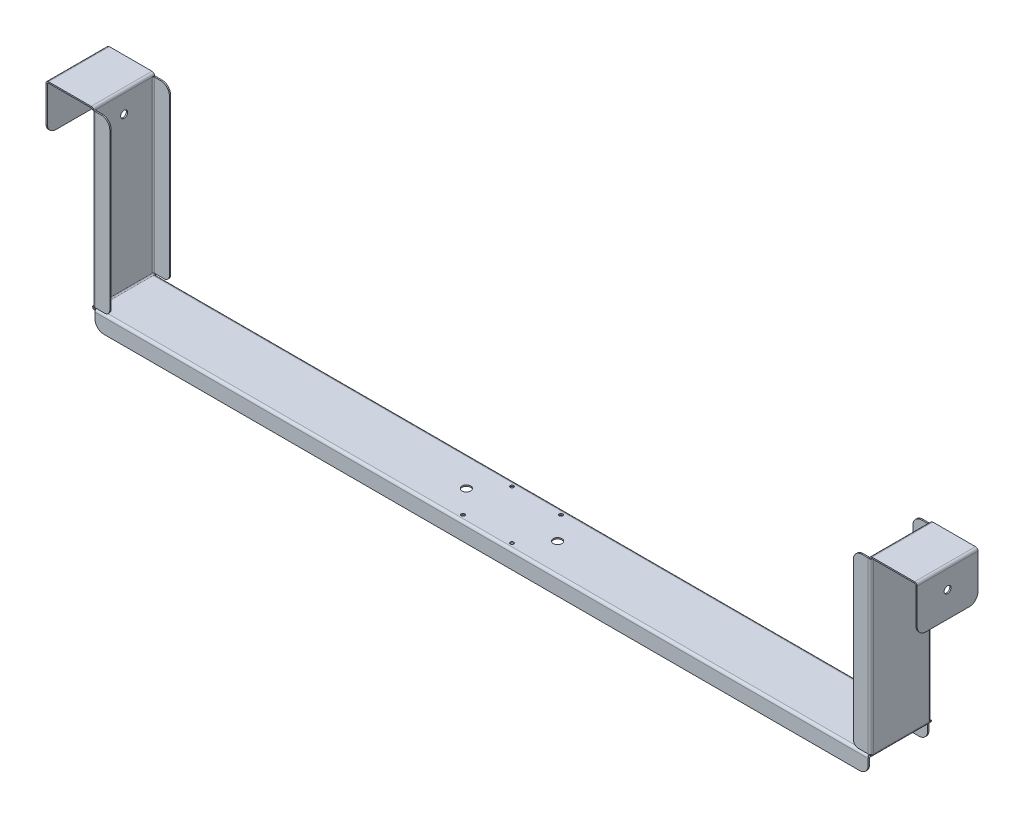
from build123d import *

# Parameters (mm, degrees)
BASE_FLANGE1_DEPTH             = 17.5
EDGE_FLANGE1_STRIP_W           = 4.4196
EDGE_FLANGE1_STRIP_H           = 0.7366
EDGE_FLANGE1_STRIP_CUT_DEPTH   = 445.0536
EDGE_FLANGE1_DEPTH             = 445.0536
EDGE_FLANGE2_STRIP_W           = 4.4196
EDGE_FLANGE2_STRIP_H           = 0.7366
EDGE_FLANGE2_STRIP_CUT_DEPTH   = 445.0536
EDGE_FLANGE2_DEPTH             = 445.0536
CUT_EXTRUDE1_DEPTH             = 512.790467768
CUT_EXTRUDE1_DEPTH_BACK        = 512.790467768
SKETCH16_R                     = 2
EDGE_FLANGE3_STRIP_W           = 4.4196
EDGE_FLANGE3_STRIP_H           = 0.7366
EDGE_FLANGE3_STRIP_CUT_DEPTH   = 97.7902
EDGE_FLANGE3_STRIP_2_W         = 4.4196
EDGE_FLANGE3_STRIP_2_H         = 0.7366
EDGE_FLANGE3_STRIP_CUT_2_DEPTH = 97.7902
EDGE_FLANGE3_DEPTH             = 97.7902
EDGE_FLANGE3_BEND_DEPTH        = 97.7902
EDGE_FLANGE4_STRIP_W           = 4.4196
EDGE_FLANGE4_STRIP_H           = 0.7366
EDGE_FLANGE4_STRIP_CUT_DEPTH   = 97.7902
EDGE_FLANGE4_STRIP_2_W         = 4.4196
EDGE_FLANGE4_STRIP_2_H         = 0.7366
EDGE_FLANGE4_STRIP_CUT_2_DEPTH = 97.7902
EDGE_FLANGE4_DEPTH             = 97.7902
EDGE_FLANGE4_BEND_DEPTH        = 97.7902
FILLET1_R                      = 5
FILLET2_R                      = 3
CUT_EXTRUDE2_DEPTH             = 271.508951016
CUT_EXTRUDE2_DEPTH_BACK        = 271.508951016
SKETCH29_R                     = 2.5
CUT_EXTRUDE3_DEPTH             = 271.508951016
CUT_EXTRUDE3_DEPTH_BACK        = 271.508951016
SKETCH30_R                     = 1


# Sheet-metal steps are written as plain solids
with BuildPart() as part:
    # Sketch1 → Base-Flange1 (new, symmetric)
    with BuildSketch(Plane.XY):
        with BuildLine():
            Line((-250, 74), (-250, 99.2634))
            ThreePointArc((-250, 99.2634), (-249.784254855, 99.784254855), (-249.2634, 100))
            Line((-249.2634, 100), (-224.7366, 100))
            ThreePointArc((-224.7366, 100), (-224.215745145, 99.784254855), (-224, 99.2634))
            Line((-224, 99.2634), (-224, 1.4732))
            ThreePointArc((-224, 1.4732), (-223.56850971, 0.43149029), (-222.5268, 0))
            Line((-222.5268, 0), (222.5268, 0))
            ThreePointArc((222.5268, 0), (223.56850971, 0.43149029), (224, 1.4732))
            Line((224, 1.4732), (224, 99.2634))
            ThreePointArc((224, 99.2634), (224.215745145, 99.784254855), (224.7366, 100))
            Line((224.7366, 100), (249.2634, 100))
            ThreePointArc((249.2634, 100), (249.784254855, 99.784254855), (250, 99.2634))
            Line((250, 99.2634), (250, 74))
            Line((250, 74), (250.7366, 74))
            Line((250.7366, 74), (250.7366, 99.2634))
            ThreePointArc((250.7366, 99.2634), (250.30510971, 100.30510971), (249.2634, 100.7366))
            Line((249.2634, 100.7366), (224.7366, 100.7366))
            ThreePointArc((224.7366, 100.7366), (223.69489029, 100.30510971), (223.2634, 99.2634))
            Line((223.2634, 99.2634), (223.2634, 1.4732))
            ThreePointArc((223.2634, 1.4732), (223.047654855, 0.952345145), (222.5268, 0.7366))
            Line((222.5268, 0.7366), (-222.5268, 0.7366))
            ThreePointArc((-222.5268, 0.7366), (-223.047654855, 0.952345145), (-223.2634, 1.4732))
            Line((-223.2634, 1.4732), (-223.2634, 99.2634))
            ThreePointArc((-223.2634, 99.2634), (-223.69489029, 100.30510971), (-224.7366, 100.7366))
            Line((-224.7366, 100.7366), (-249.2634, 100.7366))
            ThreePointArc((-249.2634, 100.7366), (-250.30510971, 100.30510971), (-250.7366, 99.2634))
            Line((-250.7366, 99.2634), (-250.7366, 74))
            Line((-250.7366, 74), (-250, 74))
        make_face()
    extrude(amount=BASE_FLANGE1_DEPTH, both=True)

    # Edge-Flange1 strip (across the edge) → Edge-Flange1 strip cut (cut)
    with BuildSketch(Plane(origin=(222.5268, 0, 17.5), x_dir=(0, 0, -1), z_dir=(-1, 0, 0))):
        with Locations((-0.7366, -0.3683)):
            Rectangle(EDGE_FLANGE1_STRIP_W, EDGE_FLANGE1_STRIP_H)
    extrude(amount=EDGE_FLANGE1_STRIP_CUT_DEPTH, mode=Mode.SUBTRACT)

    # Edge-Flange1 section (across the edge) → Edge-Flange1 (add)
    with BuildSketch(Plane(origin=(222.5268, 0, 17.5), x_dir=(0, 0, -1), z_dir=(-1, 0, 0))):
        with BuildLine():
            Line((0, 0.7366), (0, 9.2634))
            Line((0, 9.2634), (0.7366, 9.2634))
            Line((0.7366, 9.2634), (0.7366, 0.7366))
            ThreePointArc((0.7366, 0.7366), (0.952345145, 0.215745145), (1.4732, 0))
            Line((1.4732, 0), (1.4732, -0.7366))
            ThreePointArc((1.4732, -0.7366), (0.43149029, -0.30510971), (0, 0.7366))
        make_face()
    extrude(amount=EDGE_FLANGE1_DEPTH)

    # Edge-Flange2 strip (across the edge) → Edge-Flange2 strip cut (cut)
    with BuildSketch(Plane(origin=(-222.5268, 0, -17.5), x_dir=(0, 0, 1), z_dir=(1, 0, 0))):
        with Locations((-0.7366, -0.3683)):
            Rectangle(EDGE_FLANGE2_STRIP_W, EDGE_FLANGE2_STRIP_H)
    extrude(amount=EDGE_FLANGE2_STRIP_CUT_DEPTH, mode=Mode.SUBTRACT)

    # Edge-Flange2 section (across the edge) → Edge-Flange2 (add)
    with BuildSketch(Plane(origin=(-222.5268, 0, -17.5), x_dir=(0, 0, 1), z_dir=(1, 0, 0))):
        with BuildLine():
            Line((0, 0.7366), (0, 9.2634))
            Line((0, 9.2634), (0.7366, 9.2634))
            Line((0.7366, 9.2634), (0.7366, 0.7366))
            ThreePointArc((0.7366, 0.7366), (0.952345145, 0.215745145), (1.4732, 0))
            Line((1.4732, 0), (1.4732, -0.7366))
            ThreePointArc((1.4732, -0.7366), (0.43149029, -0.30510971), (0, 0.7366))
        make_face()
    extrude(amount=EDGE_FLANGE2_DEPTH)

    # Sketch16 → Cut-Extrude1 (cut, two sides: drawn at the far end of the back side and taken through both)
    with BuildSketch(Plane(origin=(250.7366, 0, 0), x_dir=(0, 0, -1), z_dir=(1, 0, 0)).offset(-CUT_EXTRUDE1_DEPTH_BACK)):
        with Locations(Location((0, 88.7366, 0), (0, 0, 180))):
            Circle(SKETCH16_R)
    extrude(amount=CUT_EXTRUDE1_DEPTH + CUT_EXTRUDE1_DEPTH_BACK, mode=Mode.SUBTRACT)

    # Edge-Flange3 strip (across the edge) → Edge-Flange3 strip cut (cut)
    with BuildSketch(Plane(origin=(-223.2634, 99.2634, 17.5), x_dir=(0, 0, -1), z_dir=(0, -1, 0))):
        with Locations((-0.7366, -0.3683)):
            Rectangle(EDGE_FLANGE3_STRIP_W, EDGE_FLANGE3_STRIP_H)
    extrude(amount=EDGE_FLANGE3_STRIP_CUT_DEPTH, mode=Mode.SUBTRACT)

    # Edge-Flange3 strip 2 (across the edge) → Edge-Flange3 strip cut 2 (cut)
    with BuildSketch(Plane(origin=(-223.2634, 1.4732, -17.5), x_dir=(0, 0, 1), z_dir=(0, 1, 0))):
        with Locations((-0.7366, -0.3683)):
            Rectangle(EDGE_FLANGE3_STRIP_2_W, EDGE_FLANGE3_STRIP_2_H)
    extrude(amount=EDGE_FLANGE3_STRIP_CUT_2_DEPTH, mode=Mode.SUBTRACT)

    # Edge-Flange3 section (across the edge) → Edge-Flange3 (add)
    with BuildSketch(Plane(origin=(-223.2634, 99.2634, 17.5), x_dir=(0, 0, -1), z_dir=(0, -1, 0))):
        with BuildLine():
            Line((0, 0.7366), (0, 9.2634))
            Line((0, 9.2634), (0.7366, 9.2634))
            Line((0.7366, 9.2634), (0.7366, 0.7366))
            ThreePointArc((0.7366, 0.7366), (0.952345145, 0.215745145), (1.4732, 0))
            Line((1.4732, 0), (1.4732, -0.7366))
            ThreePointArc((1.4732, -0.7366), (0.43149029, -0.30510971), (0, 0.7366))
        make_face()
    extrude(amount=EDGE_FLANGE3_DEPTH)

    # Edge-Flange3 section 2 (across the edge) → Edge-Flange3 bend (add)
    with BuildSketch(Plane(origin=(-223.2634, 1.4732, -17.5), x_dir=(0, 0, 1), z_dir=(0, 1, 0))):
        with BuildLine():
            Line((0, 0.7366), (0, 9.2634))
            Line((0, 9.2634), (0.7366, 9.2634))
            Line((0.7366, 9.2634), (0.7366, 0.7366))
            ThreePointArc((0.7366, 0.7366), (0.952345145, 0.215745145), (1.4732, 0))
            Line((1.4732, 0), (1.4732, -0.7366))
            ThreePointArc((1.4732, -0.7366), (0.43149029, -0.30510971), (0, 0.7366))
        make_face()
    extrude(amount=EDGE_FLANGE3_BEND_DEPTH)

    # Edge-Flange4 strip (across the edge) → Edge-Flange4 strip cut (cut)
    with BuildSketch(Plane(origin=(223.2634, 1.4732, 17.5), x_dir=(0, 0, -1), z_dir=(0, 1, 0))):
        with Locations((-0.7366, -0.3683)):
            Rectangle(EDGE_FLANGE4_STRIP_W, EDGE_FLANGE4_STRIP_H)
    extrude(amount=EDGE_FLANGE4_STRIP_CUT_DEPTH, mode=Mode.SUBTRACT)

    # Edge-Flange4 strip 2 (across the edge) → Edge-Flange4 strip cut 2 (cut)
    with BuildSketch(Plane(origin=(223.2634, 99.2634, -17.5), x_dir=(0, 0, 1), z_dir=(0, -1, 0))):
        with Locations((-0.7366, -0.3683)):
            Rectangle(EDGE_FLANGE4_STRIP_2_W, EDGE_FLANGE4_STRIP_2_H)
    extrude(amount=EDGE_FLANGE4_STRIP_CUT_2_DEPTH, mode=Mode.SUBTRACT)

    # Edge-Flange4 section (across the edge) → Edge-Flange4 (add)
    with BuildSketch(Plane(origin=(223.2634, 1.4732, 17.5), x_dir=(0, 0, -1), z_dir=(0, 1, 0))):
        with BuildLine():
            Line((0, 0.7366), (0, 9.2634))
            Line((0, 9.2634), (0.7366, 9.2634))
            Line((0.7366, 9.2634), (0.7366, 0.7366))
            ThreePointArc((0.7366, 0.7366), (0.952345145, 0.215745145), (1.4732, 0))
            Line((1.4732, 0), (1.4732, -0.7366))
            ThreePointArc((1.4732, -0.7366), (0.43149029, -0.30510971), (0, 0.7366))
        make_face()
    extrude(amount=EDGE_FLANGE4_DEPTH)

    # Edge-Flange4 section 2 (across the edge) → Edge-Flange4 bend (add)
    with BuildSketch(Plane(origin=(223.2634, 99.2634, -17.5), x_dir=(0, 0, 1), z_dir=(0, -1, 0))):
        with BuildLine():
            Line((0, 0.7366), (0, 9.2634))
            Line((0, 9.2634), (0.7366, 9.2634))
            Line((0.7366, 9.2634), (0.7366, 0.7366))
            ThreePointArc((0.7366, 0.7366), (0.952345145, 0.215745145), (1.4732, 0))
            Line((1.4732, 0), (1.4732, -0.7366))
            ThreePointArc((1.4732, -0.7366), (0.43149029, -0.30510971), (0, 0.7366))
        make_face()
    extrude(amount=EDGE_FLANGE4_BEND_DEPTH)

    # Fillet1
    fillet1_edges = [part.edges().sort_by_distance(p)[0] for p in [
        (222.5268, -9.2634, 17.1317),
        (-222.5268, -9.2634, 17.1317),
        (-222.5268, -9.2634, -17.1317),
        (222.5268, -9.2634, -17.1317),
        (-214, 99.2634, 17.1317),
        (250.3683, 74, -17.5),
        (-214, 99.2634, -17.1317),
        (-250.3683, 74, -17.5),
        (214, 99.2634, 17.1317),
        (214, 99.2634, -17.1317),
        (250.3683, 74, 17.5),
        (-250.3683, 74, 17.5),
    ]]
    fillet(fillet1_edges, radius=FILLET1_R)

    # Fillet2
    fillet2_edges = [part.edges().sort_by_distance(p)[0] for p in [
        (-214, 1.4732, 17.1317),
        (-214, 1.4732, -17.1317),
        (214, 1.4732, 17.1317),
        (214, 1.4732, -17.1317),
    ]]
    fillet(fillet2_edges, radius=FILLET2_R)

    # Sketch29 → Cut-Extrude2 (cut, two sides: drawn at the far end of the back side and taken through both)
    with BuildSketch(Plane(origin=(0, 0.7366, 0), x_dir=(1, 0, 0), z_dir=(0, 1, 0)).offset(-CUT_EXTRUDE2_DEPTH_BACK)):
        with Locations(Location((-26.25, 0, 0), (0, 0, 90))):
            Circle(SKETCH29_R)
        with Locations(Location((26.25, 0, 0), (0, 0, 90))):
            Circle(SKETCH29_R)
    extrude(amount=CUT_EXTRUDE2_DEPTH + CUT_EXTRUDE2_DEPTH_BACK, mode=Mode.SUBTRACT)

    # Sketch30 → Cut-Extrude3 (cut, two sides: drawn at the far end of the back side and taken through both)
    with BuildSketch(Plane(origin=(0, 0.7366, 0), x_dir=(1, 0, 0), z_dir=(0, 1, 0)).offset(-CUT_EXTRUDE3_DEPTH_BACK)):
        with Locations(Location((-14.1, 14.1, 0), (0, 0, 90))):
            Circle(SKETCH30_R)
        with Locations(Location((14.1, 14.1, 0), (0, 0, 90))):
            Circle(SKETCH30_R)
        with Locations(Location((14.1, -14.1, 0), (0, 0, 90))):
            Circle(SKETCH30_R)
        with Locations(Location((-14.1, -14.1, 0), (0, 0, 90))):
            Circle(SKETCH30_R)
    extrude(amount=CUT_EXTRUDE3_DEPTH + CUT_EXTRUDE3_DEPTH_BACK, mode=Mode.SUBTRACT)


solid = part.part
